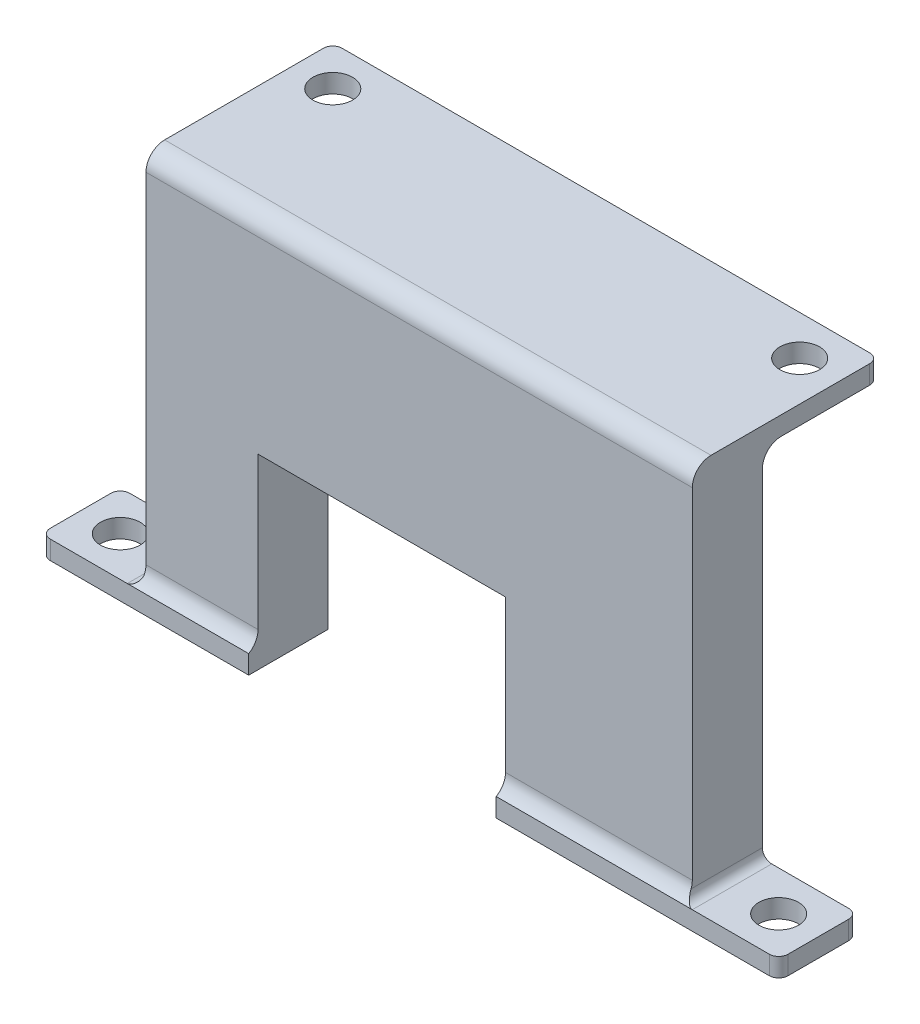
from build123d import *

# Parameters (mm, degrees)
SKETCH1_W           = 79
SKETCH1_H           = 8.5
SKETCH1_R           = 2.125
BOSS_EXTRUDE1_DEPTH = 2
SKETCH3_W           = 58.5
SKETCH3_H           = 7.5
BOSS_EXTRUDE2_DEPTH = 40.14
SKETCH4_W           = 58.5
SKETCH4_H           = 2
BOSS_EXTRUDE3_DEPTH = 12.5
CUT_EXTRUDE1_REACH  = 93.966
SKETCH5_R           = 2.125
FILLET1_R           = 2
FILLET2_R           = 1
FILLET3_R           = 2
FILLET4_R           = 1
FILLET5_R           = 1
SKETCH6_W           = 26.5
SKETCH6_H           = 20
CUT_EXTRUDE2_DEPTH  = 10


with BuildPart() as part:
    # Sketch1 → Boss-Extrude1 (new body)
    with BuildSketch(Plane(origin=(0, 0, 0), x_dir=(1, 0, 0), z_dir=(0, 1, 0))):
        with Locations((-39.5, 4.25)):
            Rectangle(SKETCH1_W, SKETCH1_H)
        with Locations(Location((-74.75, 4.25, 0), (0, 0, 270))):
            Circle(SKETCH1_R, mode=Mode.SUBTRACT)
        with Locations(Location((-4.25, 4.25, 0), (0, 0, 270))):
            Circle(SKETCH1_R, mode=Mode.SUBTRACT)
    extrude(amount=BOSS_EXTRUDE1_DEPTH)

    # Sketch3 → Boss-Extrude2 (add)
    with BuildSketch(Plane(origin=(0, 2, 0), x_dir=(1, 0, 0), z_dir=(0, 1, 0))):
        with Locations((-39.5, 4.75)):
            Rectangle(SKETCH3_W, SKETCH3_H)
    extrude(amount=BOSS_EXTRUDE2_DEPTH)

    # Sketch4 → Boss-Extrude3 (add)
    with BuildSketch(Plane(origin=(0, 0, -8.5), x_dir=(-1, 0, 0), z_dir=(0, 0, -1))):
        with Locations((39.5, 41.14)):
            Rectangle(SKETCH4_W, SKETCH4_H)
    extrude(amount=BOSS_EXTRUDE3_DEPTH)

    # Sketch5 → Cut-Extrude1 (cut, up to next)
    with BuildSketch(Plane(origin=(0, 42.14, 0), x_dir=(1, 0, 0), z_dir=(0, 1, 0)), mode=Mode.PRIVATE) as cut_extrude1_sk1:
        with Locations(Location((-14.5, 16.75, 0), (0, 0, 270))):
            Circle(SKETCH5_R)
    cut_extrude1_tool1 = extrude(cut_extrude1_sk1.sketch, amount=-CUT_EXTRUDE1_REACH, mode=Mode.PRIVATE) & part.part
    # Sketch5 → Cut-Extrude1 (cut, up to next)
    with BuildSketch(Plane(origin=(0, 42.14, 0), x_dir=(1, 0, 0), z_dir=(0, 1, 0)), mode=Mode.PRIVATE) as cut_extrude1_sk2:
        with Locations(Location((-64.5, 16.75, 0), (0, 0, 270))):
            Circle(SKETCH5_R)
    cut_extrude1_tool2 = extrude(cut_extrude1_sk2.sketch, amount=-CUT_EXTRUDE1_REACH, mode=Mode.PRIVATE) & part.part
    add(cut_extrude1_tool1.solids().sort_by_distance((-14.5, 42.14, -16.75))[0], mode=Mode.SUBTRACT)
    add(cut_extrude1_tool2.solids().sort_by_distance((-64.5, 42.14, -16.75))[0], mode=Mode.SUBTRACT)

    # Fillet1
    # the kernel refuses this fillet: 2 mm, written as the material it adds along each edge
    with BuildSketch(Plane(origin=(-68.75, 40.14, -8.5), x_dir=(0, -1, 0), z_dir=(1, 0, 0))) as fillet1_piece_1:
        with BuildLine():
            CenterArc((FILLET1_R, FILLET1_R), FILLET1_R, 180, 90)
            Line((0, FILLET1_R), (-FILLET1_R * 0.02, FILLET1_R))
            Line((-FILLET1_R * 0.02, FILLET1_R), (-FILLET1_R * 0.02, -FILLET1_R * 0.02))
            Line((-FILLET1_R * 0.02, -FILLET1_R * 0.02), (FILLET1_R, -FILLET1_R * 0.02))
            Line((FILLET1_R, -FILLET1_R * 0.02), (FILLET1_R, 0))
        make_face()
    extrude(amount=58.5)
    with BuildSketch(Plane(origin=(-68.75, 2, -1), x_dir=(0, 0, 1), z_dir=(1, 0, 0))) as fillet1_piece_2:
        with BuildLine():
            CenterArc((2, -1.732050808), FILLET1_R, 120, 60)
            Line((0, -1.732050808), (-0.04, -1.732050808))
            Line((-0.04, -1.732050808), (-0.04, 0))
            Line((-0.04, 0), (0, 0.04))
            ThreePointArc((0, 0.04), (0.5, 0.04), (0.98, 0.034641016))
            Line((0.98, 0.034641016), (1, 0))
        make_face()
    extrude(amount=58.5)

    # Fillet2
    fillet2_edges = [part.edges().sort_by_distance(p)[0] for p in [
        (-79, 1, 0),
        (-79, 1, -8.5),
        (-68.75, 41.14, -21),
        (-10.25, 41.14, -21),
        (0, 1, -8.5),
        (0, 1, 0),
    ]]
    fillet(fillet2_edges, radius=FILLET2_R)

    # Fillet3
    fillet3_edges = [part.edges().sort_by_distance(p)[0] for p in [
        (-39.5, 42.14, -1),
    ]]
    fillet(fillet3_edges, radius=FILLET3_R)

    # Fillet4
    # the kernel refuses this fillet: 1 mm, written as the material it adds along each edge
    with BuildSketch(Plane(origin=(-10.25, 2, 0), x_dir=(0, 1, 0), z_dir=(0, 0, -1))) as fillet4_piece_1_section:
        with BuildLine():
            CenterArc((FILLET4_R, FILLET4_R), FILLET4_R, 180, 90)
            Line((0, FILLET4_R), (0, 0))
            Line((0, 0), (FILLET4_R, 0))
        make_face()
    fillet4_piece_1 = extrude(amount=8.5, mode=Mode.PRIVATE)
    fillet4_piece_1 = fillet4_piece_1 - Plane(origin=(-10.019982346, 3.732050808, 1), x_dir=(0, 0, 1), z_dir=(-1, 0, 0)) * Cylinder(2, 21, mode=Mode.PRIVATE)
    add(fillet4_piece_1)

    # Fillet5
    # the kernel refuses this fillet: 1 mm, written as the material it adds along each edge
    with BuildSketch(Plane(origin=(-68.75, 2, -8.5), x_dir=(-1, 0, 0), z_dir=(0, 0, 1))) as fillet5_piece_1_section:
        with BuildLine():
            CenterArc((FILLET5_R, -FILLET5_R), FILLET5_R, 90, 90)
            Line((0, -FILLET5_R), (0, 0))
            Line((0, 0), (FILLET5_R, 0))
        make_face()
    fillet5_piece_1 = extrude(amount=8.5, mode=Mode.PRIVATE)
    fillet5_piece_1 = fillet5_piece_1 - Plane(origin=(-68.980019627, 3.732050808, 1), x_dir=(0, 0, 1), z_dir=(-1, 0, 0)) * Cylinder(2, 21, mode=Mode.PRIVATE)
    add(fillet5_piece_1)

    # Sketch6 → Cut-Extrude2 (cut)
    with BuildSketch(Plane(origin=(0, 0, -8.5), x_dir=(-1, 0, 0), z_dir=(0, 0, -1))):
        with Locations((43.5, 10)):
            Rectangle(SKETCH6_W, SKETCH6_H)
    extrude(amount=-CUT_EXTRUDE2_DEPTH, mode=Mode.SUBTRACT)


solid = part.part
